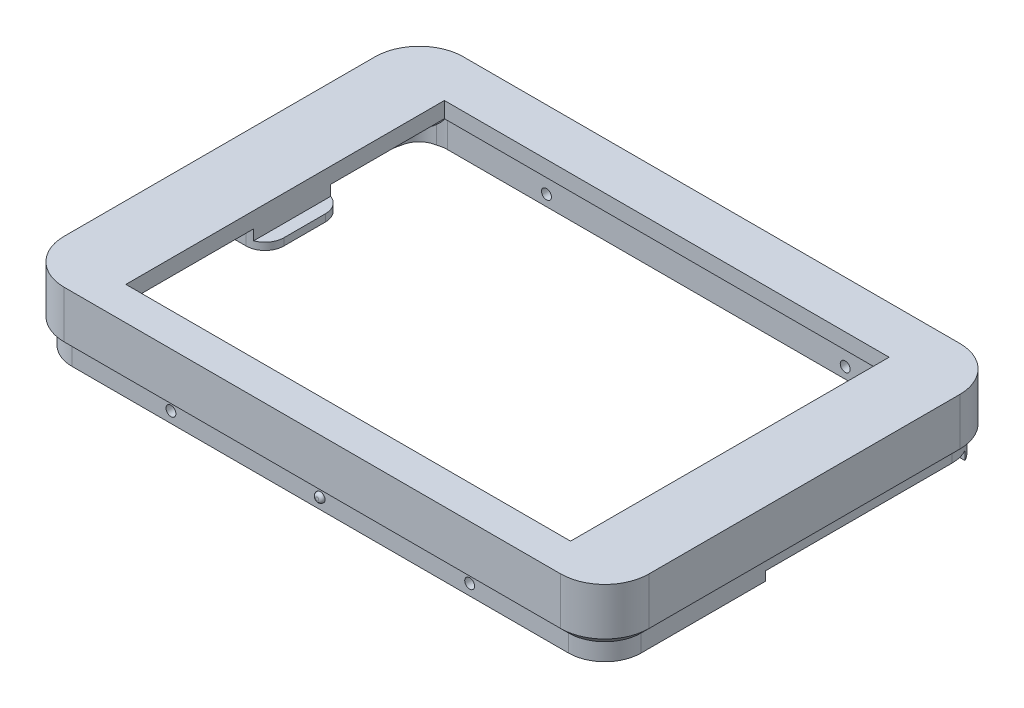
from build123d import *
from build123d.topology import SkipClean

# Parameters (mm, degrees)
BOSS_EXTRUDE1_DEPTH = 4.5
SHELL1_T            = -2.5
SKETCH2_W           = 70.5
SKETCH2_H           = 50.5
CUT_EXTRUDE1_DEPTH  = 6
FILLET1_R           = 2
SKETCH3_R           = 3.25
SKETCH3_R_2         = 1.25
BOSS_EXTRUDE2_DEPTH = 2.5
BOSS_EXTRUDE3_START = 3
BOSS_EXTRUDE3_DEPTH = 3
SKETCH5_W           = 12.567423642
SKETCH5_H           = 1.646842997
BOSS_EXTRUDE4_DEPTH = 4
BOSS_EXTRUDE5_DEPTH = 12.567423642
FILLET4_R           = 3
SKETCH8_W           = 70.5
SKETCH8_H           = 50.5
CUT_EXTRUDE2_DEPTH  = 4
BOSS_EXTRUDE6_START = 4
BOSS_EXTRUDE6_DEPTH = 4
CHAMFER1_SIZE       = 1.25
SKETCH11_W          = 15.487290784
SKETCH11_H          = 50.5
CUT_EXTRUDE3_DEPTH  = 24
CUT_EXTRUDE4_START  = -6.5
SKETCH13_R          = 3.25
CUT_EXTRUDE4_DEPTH  = 6.5
SKETCH14_R          = 0.75
BOSS_EXTRUDE7_DEPTH = 0.5
FILLET5_R           = 0.5
BOSS_EXTRUDE8_START = 0.5
SKETCH15_R          = 0.75
BOSS_EXTRUDE8_DEPTH = 0.5
FILLET6_R           = 0.5
SKETCH16_W          = 32.358974192
SKETCH16_H          = 1.7505668
CUT_EXTRUDE5_DEPTH  = 20.5
SKETCH17_R          = 0.783892082
CUT_EXTRUDE6_DEPTH  = 78.755475754


# Some blends are built 0.0001 mm under size
with BuildPart() as part:
    # Sketch1 → Boss-Extrude1 (new body)
    with BuildSketch(Plane(origin=(0, 0, 0), x_dir=(1, 0, 0), z_dir=(0, 1, 0))):
        with BuildLine():
            Line((46.356686108, -24.641010635), (46.356686108, 24.641010635))
            ThreePointArc((46.356686108, 24.641010635), (44.306433576, 29.590758103), (39.356686108, 31.641010635))
            Line((39.356686108, 31.641010635), (-39.356686108, 31.641010635))
            ThreePointArc((-39.356686108, 31.641010635), (-44.306433576, 29.590758103), (-46.356686108, 24.641010635))
            Line((-46.356686108, 24.641010635), (-46.356686108, -24.641010635))
            ThreePointArc((-46.356686108, -24.641010635), (-44.306433576, -29.590758103), (-39.356686108, -31.641010635))
            Line((-39.356686108, -31.641010635), (39.356686108, -31.641010635))
            ThreePointArc((39.356686108, -31.641010635), (44.306433576, -29.590758103), (46.356686108, -24.641010635))
        make_face()
    extrude(amount=BOSS_EXTRUDE1_DEPTH)

    # Shell1
    shell1_openings = [part.faces().sort_by_distance(p)[0] for p in [
        (0, 0, 0),
    ]]
    offset(amount=SHELL1_T, openings=shell1_openings, kind=Kind.INTERSECTION)

    # Sketch2 → Cut-Extrude1 (cut)
    with BuildSketch(Plane(origin=(0, 4.5, 0), x_dir=(1, 0, 0), z_dir=(0, 1, 0))):
        with Locations((0.393313892, -1.108989365)):
            Rectangle(SKETCH2_W, SKETCH2_H)
    extrude(amount=-CUT_EXTRUDE1_DEPTH, mode=Mode.SUBTRACT)

    # Fillet1
    fillet1_edges = [part.edges().sort_by_distance(p)[0] for p in [
        (42.538666623, 2, 27.82299115),
        (0, 2, 29.141010635),
        (-42.538666623, 2, 27.82299115),
        (-43.856686108, 2, 0),
        (-42.538666623, 2, -27.82299115),
        (0, 2, -29.141010635),
        (42.538666623, 2, -27.82299115),
        (43.856686108, 2, 0),
    ]]
    fillet(fillet1_edges, radius=FILLET1_R - 0.0001)  # a hair under: the kernel refuses the full size

    # Sketch3 → Boss-Extrude2 (add)
    # profile 1 of 4: a face of its own
    with BuildSketch(Plane.XZ.offset(-2)):
        with Locations(Location((-40.393075335, 23.335972527, 0), (0, 0, 100.663495608))):
            Circle(SKETCH3_R)
        with Locations(Location((-40.393075335, 23.335972527, 0), (0, 0, 270))):
            Circle(SKETCH3_R_2, mode=Mode.SUBTRACT)
    # profile 2 of 4: a face of its own
    with BuildSketch(Plane.XZ.offset(-2)):
        with Locations(Location((-40.393075335, -25.664027473, 0), (0, 0, 116.76561408))):
            Circle(SKETCH3_R)
        with Locations(Location((-40.393075335, -25.664027473, 0), (0, 0, 179.461771678))):
            Circle(SKETCH3_R_2, mode=Mode.SUBTRACT)
    # profile 3 of 4: a face of its own
    with BuildSketch(Plane.XZ.offset(-2)):
        with Locations(Location((37.638494393, -25.664027473, 0), (0, 0, 127.872158601))):
            Circle(SKETCH3_R)
        with Locations(Location((37.638494393, -25.664027473, 0), (0, 0, 270))):
            Circle(SKETCH3_R_2, mode=Mode.SUBTRACT)
    # profile 4 of 4: a face of its own
    with BuildSketch(Plane.XZ.offset(-2)):
        with Locations(Location((37.638494393, 23.335972526, 0), (0, 0, 127.872158601))):
            Circle(SKETCH3_R)
        with Locations(Location((37.638494393, 23.335972526, 0), (0, 0, 270))):
            Circle(SKETCH3_R_2, mode=Mode.SUBTRACT)
    extrude(amount=BOSS_EXTRUDE2_DEPTH)

    # Sketch4 → Boss-Extrude3 (add)
    with SkipClean():  # the faces are left unmerged after this step: merging them gives an invalid solid
        with BuildSketch(Plane.XZ.offset(BOSS_EXTRUDE3_START)):
            with BuildLine():
                Line((39.356686108, 31.641010635), (-39.356686108, 31.641010635))
                ThreePointArc((-39.356686108, 31.641010635), (-44.306433576, 29.590758103), (-46.356686108, 24.641010635))
                Line((-46.356686108, 24.641010635), (-46.356686108, -24.641010635))
                ThreePointArc((-46.356686108, -24.641010635), (-44.306433576, -29.590758103), (-39.356686108, -31.641010635))
                Line((-39.356686108, -31.641010635), (39.356686108, -31.641010635))
                ThreePointArc((39.356686108, -31.641010635), (44.306433576, -29.590758103), (46.356686108, -24.641010635))
                Line((46.356686108, -24.641010635), (46.356686108, 24.641010635))
                ThreePointArc((46.356686108, 24.641010635), (44.306433576, 29.590758103), (39.356686108, 31.641010635))
            make_face()
            with BuildLine():
                Line((39.356686108, 29.141010635), (-39.356686108, 29.141010635))
                ThreePointArc((-39.356686108, 29.141010635), (-42.538666623, 27.82299115), (-43.856686108, 24.641010635))
                Line((-43.856686108, 24.641010635), (-43.856686108, -24.641010635))
                ThreePointArc((-43.856686108, -24.641010635), (-42.538666623, -27.82299115), (-39.356686108, -29.141010635))
                Line((-39.356686108, -29.141010635), (39.356686108, -29.141010635))
                ThreePointArc((39.356686108, -29.141010635), (42.538666623, -27.82299115), (43.856686108, -24.641010635))
                Line((43.856686108, -24.641010635), (43.856686108, 24.641010635))
                ThreePointArc((43.856686108, 24.641010635), (42.538666623, 27.82299115), (39.356686108, 29.141010635))
            make_face(mode=Mode.SUBTRACT)
        extrude(amount=-BOSS_EXTRUDE3_DEPTH)

    # Sketch5 → Boss-Extrude4 (add)
    with SkipClean():  # the faces are left unmerged after this step: merging them gives an invalid solid
        with BuildSketch(Plane(origin=(-34.856686108, 0, 0), x_dir=(0, 0, -1), z_dir=(1, 0, 0))):
            with Locations((0.008961538, 1.176578502)):
                Rectangle(SKETCH5_W, SKETCH5_H)
        extrude(amount=-BOSS_EXTRUDE4_DEPTH)

    # Sketch6 → Boss-Extrude5 (add)
    with SkipClean():  # the faces are left unmerged after this step: merging them gives an invalid solid
        with BuildSketch(Plane.XY.offset(6.274750283)):
            Polygon((-34.856686108, 0.353157003), (-32.884887287, 0.353157003), (-32.884887287, -0.785578936), (-38.308352122, -0.785578936), (-38.856686108, 0.353157003), align=None)
        extrude(amount=-BOSS_EXTRUDE5_DEPTH)

    # Fillet4
    # the kernel refuses this fillet: 3 mm, written as the material it takes off along each edge
    with BuildSketch(Plane(origin=(-32.884887287, 7.853157003, -6.292673359), x_dir=(-1, 0, 0), z_dir=(0, -1, 0))) as fillet4_piece_1_section:
        with BuildLine():
            CenterArc((FILLET4_R, -FILLET4_R), FILLET4_R, 90, 90)
            Line((0, -FILLET4_R), (0, 0))
            Line((0, 0), (FILLET4_R, 0))
        make_face()
    fillet4_piece_1 = extrude(amount=16.138735939, mode=Mode.PRIVATE)
    fillet4_piece_1 = split(fillet4_piece_1, bisect_by=Plane(origin=(-35.112153747, 2, -6.238457851), z_dir=(0, -1, 0)), keep=Keep.TOP, mode=Mode.PRIVATE)
    add(fillet4_piece_1, mode=Mode.SUBTRACT)
    with BuildSketch(Plane(origin=(-32.884887287, 7.853157003, 6.274750283), x_dir=(-1, 0, 0), z_dir=(0, -1, 0))) as fillet4_piece_2_section:
        with BuildLine():
            CenterArc((FILLET4_R, FILLET4_R), FILLET4_R, 180, 90)
            Line((0, FILLET4_R), (0, 0))
            Line((0, 0), (FILLET4_R, 0))
        make_face()
    fillet4_piece_2 = extrude(amount=16.138735939, mode=Mode.PRIVATE)
    fillet4_piece_2 = split(fillet4_piece_2, bisect_by=Plane(origin=(-35.112153747, 2, 6.220534774), z_dir=(0, -1, 0)), keep=Keep.TOP, mode=Mode.PRIVATE)
    add(fillet4_piece_2, mode=Mode.SUBTRACT)

    # Sketch8 → Cut-Extrude2 (cut)
    with BuildSketch(Plane(origin=(0, 4.5, 0), x_dir=(1, 0, 0), z_dir=(0, 1, 0))):
        with Locations((0.393313892, -1.108989365)):
            Rectangle(SKETCH8_W, SKETCH8_H)
    extrude(amount=-CUT_EXTRUDE2_DEPTH, mode=Mode.SUBTRACT)

    # Sketch10 → Boss-Extrude6 (add)
    with BuildSketch(Plane.XZ.offset(3).offset(BOSS_EXTRUDE6_START)):
        with BuildLine():
            Line((-39.356686108, -30.391010635), (39.356686108, -30.391010635))
            ThreePointArc((39.356686108, -30.391010635), (43.4225501, -28.706874627), (45.106686108, -24.641010635))
            Line((45.106686108, -24.641010635), (45.106686108, 24.641010635))
            ThreePointArc((45.106686108, 24.641010635), (43.4225501, 28.706874627), (39.356686108, 30.391010635))
            Line((39.356686108, 30.391010635), (-39.356686108, 30.391010635))
            ThreePointArc((-39.356686108, 30.391010635), (-43.4225501, 28.706874627), (-45.106686108, 24.641010635))
            Line((-45.106686108, 24.641010635), (-45.106686108, -24.641010635))
            ThreePointArc((-45.106686108, -24.641010635), (-43.4225501, -28.706874627), (-39.356686108, -30.391010635))
        make_face()
        with BuildLine():
            Line((-39.356686108, -29.141010635), (39.356686108, -29.141010635))
            ThreePointArc((39.356686108, -29.141010635), (42.538666623, -27.82299115), (43.856686108, -24.641010635))
            Line((43.856686108, -24.641010635), (43.856686108, 24.641010635))
            ThreePointArc((43.856686108, 24.641010635), (42.538666623, 27.82299115), (39.356686108, 29.141010635))
            Line((39.356686108, 29.141010635), (-39.356686108, 29.141010635))
            ThreePointArc((-39.356686108, 29.141010635), (-42.538666623, 27.82299115), (-43.856686108, 24.641010635))
            Line((-43.856686108, 24.641010635), (-43.856686108, -24.641010635))
            ThreePointArc((-43.856686108, -24.641010635), (-42.538666623, -27.82299115), (-39.356686108, -29.141010635))
        make_face(mode=Mode.SUBTRACT)
    extrude(amount=-BOSS_EXTRUDE6_DEPTH)

    # Chamfer1
    chamfer1_edges = [part.edges().sort_by_distance(p)[0] for p in [
        (-43.4225501, -3, -28.706874627),
        (0, -3, -30.391010635),
        (43.4225501, -3, -28.706874627),
        (45.106686108, -3, 0),
        (43.4225501, -3, 28.706874627),
        (0, -3, 30.391010635),
        (-43.4225501, -3, 28.706874627),
        (-45.106686108, -3, 0),
    ]]
    chamfer(chamfer1_edges, length=CHAMFER1_SIZE - 0.0001)  # a hair under: the kernel refuses the full size

    # Sketch11 → Cut-Extrude3 (cut)
    with BuildSketch(Plane(origin=(0, 4.5, 0), x_dir=(1, 0, 0), z_dir=(0, 1, 0))):
        with Locations((27.8996685, -1.108989365)):
            Rectangle(SKETCH11_W, SKETCH11_H)
    extrude(amount=-CUT_EXTRUDE3_DEPTH, mode=Mode.SUBTRACT)

    # Sketch13 → Cut-Extrude4 (cut)
    with BuildSketch(Plane.XZ.offset(7).offset(CUT_EXTRUDE4_START)):
        with Locations((-40.393075335, -25.664027473)):
            Circle(SKETCH13_R)
    extrude(amount=CUT_EXTRUDE4_DEPTH, mode=Mode.SUBTRACT)

    # Sketch14 → Boss-Extrude7 (add)
    with BuildSketch(Plane(origin=(0, 0, -30.391010635), x_dir=(-1, 0, 0), z_dir=(0, 0, -1))):
        with Locations(Location((0, -5.25, 0), (0, 0, 180))):
            Circle(SKETCH14_R)
    extrude(amount=BOSS_EXTRUDE7_DEPTH)

    # Fillet5
    fillet5_edges = [part.edges().sort_by_distance(p)[0] for p in [
        (-0.75, -5.25, -30.891010635),
    ]]
    fillet(fillet5_edges, radius=FILLET5_R - 0.0001)  # a hair under: the kernel refuses the full size

    # Sketch15 → Boss-Extrude8 (add)
    with BuildSketch(Plane.XY.offset(30.391010635).offset(BOSS_EXTRUDE8_START)):
        with Locations(Location((0, -5.25, 0), (0, 0, 180))):
            Circle(SKETCH15_R)
    extrude(amount=-BOSS_EXTRUDE8_DEPTH)

    # Fillet6
    fillet6_edges = [part.edges().sort_by_distance(p)[0] for p in [
        (0.75, -5.25, 30.891010635),
    ]]
    fillet(fillet6_edges, radius=FILLET6_R - 0.0001)  # a hair under: the kernel refuses the full size

    # Sketch16 → Cut-Extrude5 (cut)
    with BuildSketch(Plane(origin=(45.106686108, 0, 0), x_dir=(0, 0, -1), z_dir=(1, 0, 0))):
        with Locations((11.286987709, -6.446354596)):
            Rectangle(SKETCH16_W, SKETCH16_H)
    extrude(amount=-CUT_EXTRUDE5_DEPTH, mode=Mode.SUBTRACT)

    # Sketch17 → Cut-Extrude6 (cut, through all)
    with BuildSketch(Plane(origin=(0, 0, -30.391010635), x_dir=(-1, 0, 0), z_dir=(0, 0, -1))):
        with Locations((23.679650241, -5.268916998)):
            Circle(SKETCH17_R)
        with Locations((-23.679650241, -5.268916998)):
            Circle(SKETCH17_R)
    extrude(amount=-CUT_EXTRUDE6_DEPTH, mode=Mode.SUBTRACT)


solid = part.part
